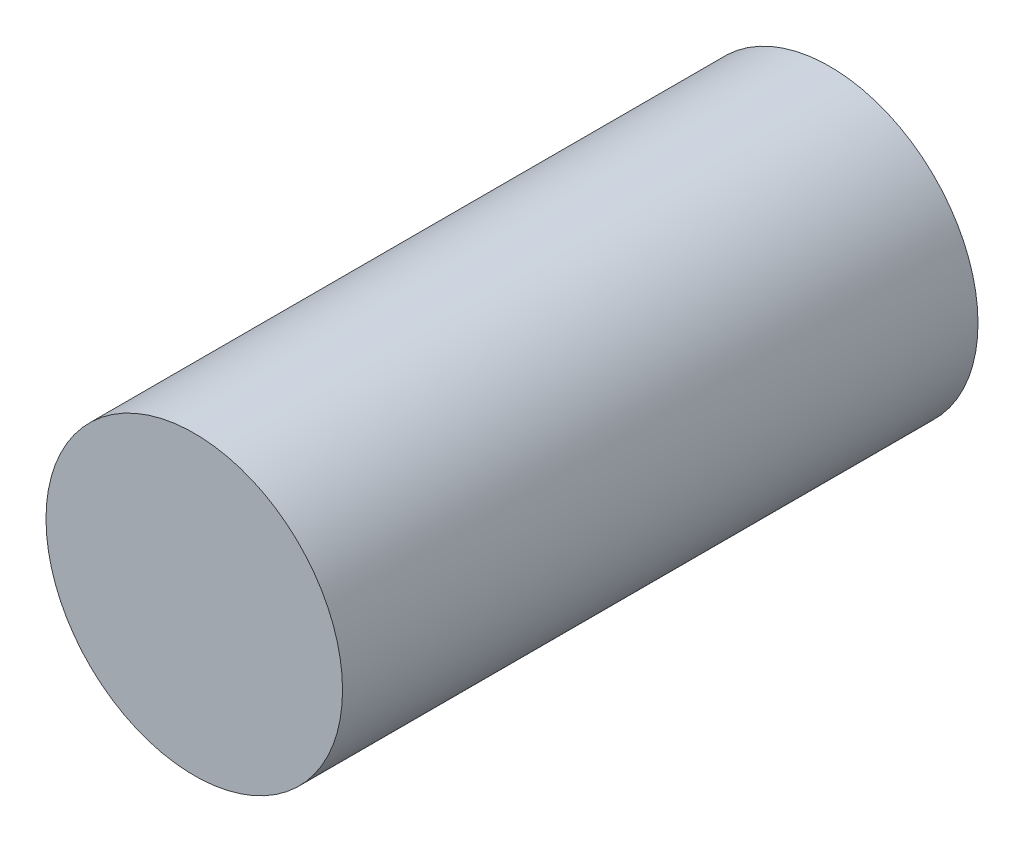
from build123d import *

# Parameters (mm, degrees)
SKETCH1_R           = 3.5
BOSS_EXTRUDE1_DEPTH = 15


with BuildPart() as part:
    # Sketch1 → Boss-Extrude1 (new body)
    with BuildSketch(Plane.XY):
        Circle(SKETCH1_R)
    extrude(amount=BOSS_EXTRUDE1_DEPTH)


solid = part.part
